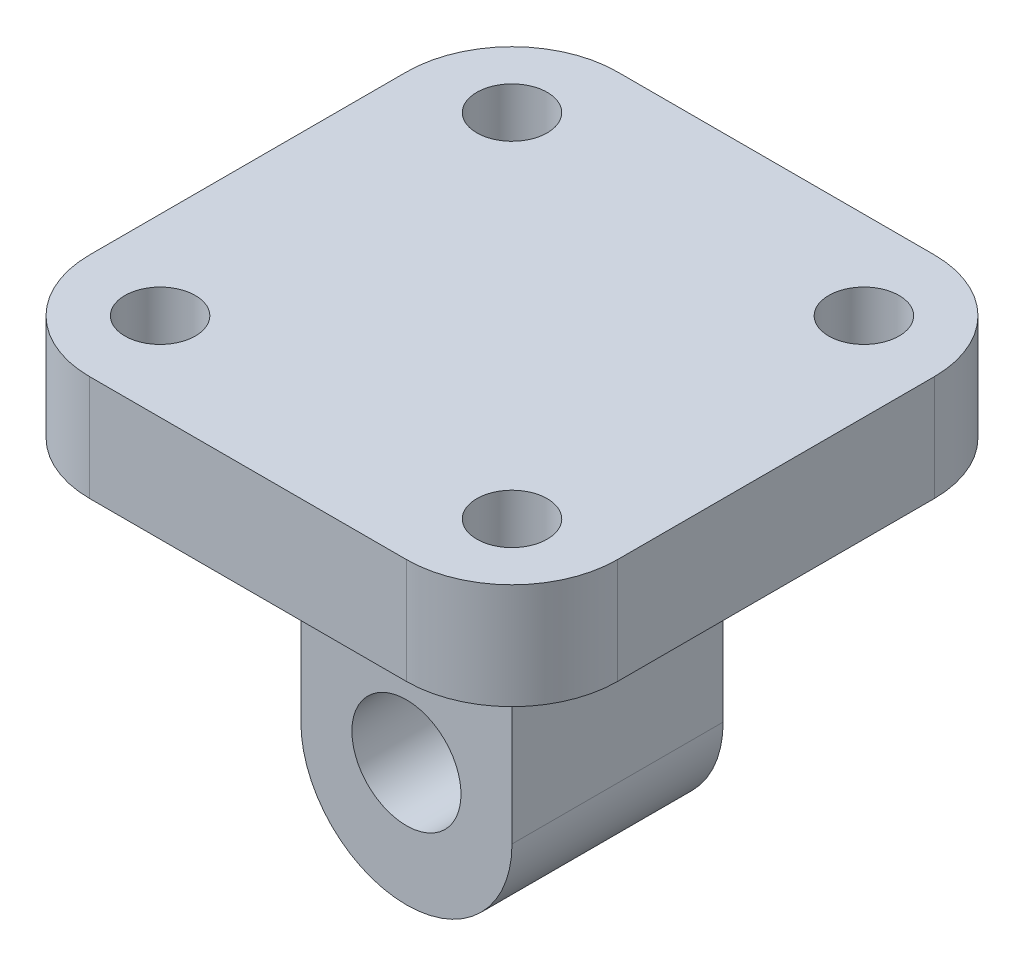
from build123d import *

# Parameters (mm, degrees)
SKETCH1_W           = 15
SKETCH1_H           = 15
BOSS_EXTRUDE1_DEPTH = 3
SKETCH3_R           = 1
CUT_EXTRUDE1_DEPTH  = 22.424285286
FILLET1_R           = 3
SKETCH4_W           = 6
SKETCH4_H           = 6
BOSS_EXTRUDE2_DEPTH = 10
SKETCH5_R           = 1.55
CUT_EXTRUDE2_DEPTH  = 21.862646045
FILLET2_R           = 3
FILLET3_R           = 2


# Some blends are built 0.0001 mm under size
with BuildPart() as part:
    # Sketch1 → Boss-Extrude1 (new body)
    with BuildSketch(Plane(origin=(0, 0, 0), x_dir=(1, 0, 0), z_dir=(0, 1, 0))):
        with Locations((7.5, -7.5)):
            Rectangle(SKETCH1_W, SKETCH1_H)
    extrude(amount=BOSS_EXTRUDE1_DEPTH)

    # Sketch3 → Cut-Extrude1 (cut, through all)
    with BuildSketch(Plane(origin=(0, 3, 0), x_dir=(1, 0, 0), z_dir=(0, 1, 0))):
        with Locations(Location((2.5, -12.5, 0), (0, 0, 270))):
            Circle(SKETCH3_R)
        with Locations(Location((12.5, -12.5, 0), (0, 0, 270))):
            Circle(SKETCH3_R)
        with Locations(Location((12.5, -2.5, 0), (0, 0, 270))):
            Circle(SKETCH3_R)
        with Locations(Location((2.5, -2.5, 0), (0, 0, 270))):
            Circle(SKETCH3_R)
    extrude(amount=-CUT_EXTRUDE1_DEPTH, mode=Mode.SUBTRACT)

    # Fillet1
    fillet1_edges = [part.edges().sort_by_distance(p)[0] for p in [
        (0, 1.5, 0),
        (15, 1.5, 0),
        (15, 1.5, 15),
        (0, 1.5, 15),
    ]]
    fillet(fillet1_edges, radius=FILLET1_R)

    # Sketch4 → Boss-Extrude2 (add)
    with BuildSketch(Plane(origin=(0, 0, 0), x_dir=(-1, 0, 0), z_dir=(0, -1, 0))):
        with Locations((-7.5, -7.5)):
            Rectangle(SKETCH4_W, SKETCH4_H)
    extrude(amount=BOSS_EXTRUDE2_DEPTH)

    # Sketch5 → Cut-Extrude2 (cut, through all)
    with BuildSketch(Plane(origin=(0, 0, 4.5), x_dir=(-1, 0, 0), z_dir=(0, 0, -1))):
        with Locations((-7.5, -6.5)):
            Circle(SKETCH5_R)
    extrude(amount=-CUT_EXTRUDE2_DEPTH, mode=Mode.SUBTRACT)

    # Fillet2
    fillet2_edges = [part.edges().sort_by_distance(p)[0] for p in [
        (10.5, -10, 7.5),
        (4.5, -10, 7.5),
    ]]
    fillet(fillet2_edges, radius=FILLET2_R - 0.0001)  # a hair under: the kernel refuses the full size

    # Fillet3
    # the kernel refuses this fillet: 2 mm, written as the material it adds along each edge
    with BuildSketch(Plane(origin=(10.5, 0, 10.5), x_dir=(0, -1, 0), z_dir=(0, 0, -1)), Plane(origin=(4.5, 0, 10.5), x_dir=(0, -1, 0), z_dir=(1, 0, 0))) as fillet3_piece_1:
        with BuildLine():
            CenterArc((FILLET3_R, -FILLET3_R), FILLET3_R, 90, 90)
            Line((0, -FILLET3_R), (0, 0))
            Line((0, 0), (FILLET3_R, 0))
        make_face()
    extrude(amount=6)
    with BuildSketch(Plane(origin=(4.5, 0, 4.5), x_dir=(-1, 0, 0), z_dir=(0, 0, 1)), Plane(origin=(10.5, 0, 4.5), x_dir=(0, 0, -1), z_dir=(-1, 0, 0))) as fillet3_piece_2:
        with BuildLine():
            CenterArc((FILLET3_R, FILLET3_R), FILLET3_R, 180, 90)
            Line((0, FILLET3_R), (0, 0))
            Line((0, 0), (FILLET3_R, 0))
        make_face()
    extrude(amount=6)
    with BuildSketch(Plane(origin=(10.5, 0, 15.5), x_dir=(0, -1, 0), z_dir=(0, 0, -1))) as fillet3_piece_3a_section:
        with BuildLine():
            CenterArc((FILLET3_R, -FILLET3_R), FILLET3_R, 90, 90)
            Line((0, -FILLET3_R), (0, 0))
            Line((0, 0), (FILLET3_R, 0))
        make_face()
    fillet3_piece_3a = extrude(amount=11, mode=Mode.PRIVATE)
    fillet3_piece_3a = split(fillet3_piece_3a, bisect_by=Plane(origin=(10.928031961, -0.460476413, 10.5), z_dir=(0, 0, 1)), keep=Keep.TOP, mode=Mode.PRIVATE)
    fillet3_piece_3a = fillet3_piece_3a & Plane(origin=(12, -0.460476413, 12), x_dir=(1, 0, 0), z_dir=(0, 1, 0)) * Cylinder(3, 30, mode=Mode.PRIVATE)
    fillet3_piece_3a = fillet3_piece_3a - Plane(origin=(12.5, -0.460476413, 12.5), x_dir=(0, 0, 1), z_dir=(0, 1, 0)) * Cylinder(1, 30, mode=Mode.PRIVATE)
    with BuildSketch(Plane(origin=(4.5, 0, 10.5), x_dir=(0, -1, 0), z_dir=(1, 0, 0))) as fillet3_piece_3b_section:
        with BuildLine():
            CenterArc((FILLET3_R, -FILLET3_R), FILLET3_R, 90, 90)
            Line((0, -FILLET3_R), (0, 0))
            Line((0, 0), (FILLET3_R, 0))
        make_face()
    fillet3_piece_3b = extrude(amount=11, mode=Mode.PRIVATE)
    fillet3_piece_3b = split(fillet3_piece_3b, bisect_by=Plane(origin=(10.5, -0.460476368, 10.928032026), z_dir=(1, 0, 0)), keep=Keep.TOP, mode=Mode.PRIVATE)
    fillet3_piece_3b = fillet3_piece_3b & Plane(origin=(12, -0.460476368, 12), x_dir=(1, 0, 0), z_dir=(0, 1, 0)) * Cylinder(3, 31, mode=Mode.PRIVATE)
    fillet3_piece_3b = fillet3_piece_3b - Plane(origin=(12.5, -0.460476368, 12.5), x_dir=(0, 0, 1), z_dir=(0, 1, 0)) * Cylinder(1, 31, mode=Mode.PRIVATE)
    fillet3_piece_3 = fillet3_piece_3a & fillet3_piece_3b
    add(fillet3_piece_3)
    with BuildSketch(Plane(origin=(10.5, 0, 10.5), x_dir=(0, -1, 0), z_dir=(0, 0, -1))) as fillet3_piece_4a_section:
        with BuildLine():
            CenterArc((FILLET3_R, -FILLET3_R), FILLET3_R, 90, 90)
            Line((0, -FILLET3_R), (0, 0))
            Line((0, 0), (FILLET3_R, 0))
        make_face()
    fillet3_piece_4a = extrude(amount=11, mode=Mode.PRIVATE)
    fillet3_piece_4a = split(fillet3_piece_4a, bisect_by=Plane(origin=(10.928032026, -0.460476368, 4.5), z_dir=(0, 0, -1)), keep=Keep.TOP, mode=Mode.PRIVATE)
    fillet3_piece_4a = fillet3_piece_4a & Plane(origin=(12, -0.460476368, 3), x_dir=(0, 0, -1), z_dir=(0, 1, 0)) * Cylinder(3, 30, mode=Mode.PRIVATE)
    fillet3_piece_4a = fillet3_piece_4a - Plane(origin=(12.5, -0.460476368, 2.5), x_dir=(0, 0, 1), z_dir=(0, 1, 0)) * Cylinder(1, 30, mode=Mode.PRIVATE)
    with BuildSketch(Plane(origin=(15.5, 0, 4.5), x_dir=(0, 0, -1), z_dir=(-1, 0, 0))) as fillet3_piece_4b_section:
        with BuildLine():
            CenterArc((FILLET3_R, FILLET3_R), FILLET3_R, 180, 90)
            Line((0, FILLET3_R), (0, 0))
            Line((0, 0), (FILLET3_R, 0))
        make_face()
    fillet3_piece_4b = extrude(amount=11, mode=Mode.PRIVATE)
    fillet3_piece_4b = split(fillet3_piece_4b, bisect_by=Plane(origin=(10.5, -0.460476818, 4.071968325), z_dir=(1, 0, 0)), keep=Keep.TOP, mode=Mode.PRIVATE)
    fillet3_piece_4b = fillet3_piece_4b & Plane(origin=(12, -0.460476818, 3), x_dir=(0, 0, -1), z_dir=(0, 1, 0)) * Cylinder(3, 30, mode=Mode.PRIVATE)
    fillet3_piece_4b = fillet3_piece_4b - Plane(origin=(12.5, -0.460476818, 2.5), x_dir=(0, 0, 1), z_dir=(0, 1, 0)) * Cylinder(1, 30, mode=Mode.PRIVATE)
    fillet3_piece_4 = fillet3_piece_4a & fillet3_piece_4b
    add(fillet3_piece_4)
    with BuildSketch(Plane(origin=(-0.5, 0, 10.5), x_dir=(0, -1, 0), z_dir=(1, 0, 0))) as fillet3_piece_5a_section:
        with BuildLine():
            CenterArc((FILLET3_R, -FILLET3_R), FILLET3_R, 90, 90)
            Line((0, -FILLET3_R), (0, 0))
            Line((0, 0), (FILLET3_R, 0))
        make_face()
    fillet3_piece_5a = extrude(amount=11, mode=Mode.PRIVATE)
    fillet3_piece_5a = split(fillet3_piece_5a, bisect_by=Plane(origin=(4.5, -0.460476374, 10.928031998), z_dir=(-1, 0, 0)), keep=Keep.TOP, mode=Mode.PRIVATE)
    fillet3_piece_5a = fillet3_piece_5a & Plane(origin=(3, -0.460476374, 12), x_dir=(-1, 0, 0), z_dir=(0, 1, 0)) * Cylinder(3, 30, mode=Mode.PRIVATE)
    fillet3_piece_5a = fillet3_piece_5a - Plane(origin=(2.5, -0.460476374, 12.5), x_dir=(0, 0, 1), z_dir=(0, 1, 0)) * Cylinder(1, 30, mode=Mode.PRIVATE)
    with BuildSketch(Plane(origin=(4.5, 0, 4.5), x_dir=(-1, 0, 0), z_dir=(0, 0, 1))) as fillet3_piece_5b_section:
        with BuildLine():
            CenterArc((FILLET3_R, FILLET3_R), FILLET3_R, 180, 90)
            Line((0, FILLET3_R), (0, 0))
            Line((0, 0), (FILLET3_R, 0))
        make_face()
    fillet3_piece_5b = extrude(amount=11, mode=Mode.PRIVATE)
    fillet3_piece_5b = split(fillet3_piece_5b, bisect_by=Plane(origin=(4.071967841, -0.460476686, 10.5), z_dir=(0, 0, 1)), keep=Keep.TOP, mode=Mode.PRIVATE)
    fillet3_piece_5b = fillet3_piece_5b & Plane(origin=(3, -0.460476686, 12), x_dir=(-1, 0, 0), z_dir=(0, 1, 0)) * Cylinder(3, 30, mode=Mode.PRIVATE)
    fillet3_piece_5b = fillet3_piece_5b - Plane(origin=(2.5, -0.460476686, 12.5), x_dir=(0, 0, 1), z_dir=(0, 1, 0)) * Cylinder(1, 30, mode=Mode.PRIVATE)
    fillet3_piece_5 = fillet3_piece_5a & fillet3_piece_5b
    add(fillet3_piece_5)
    with BuildSketch(Plane(origin=(4.5, 0, -0.5), x_dir=(-1, 0, 0), z_dir=(0, 0, 1))) as fillet3_piece_6a_section:
        with BuildLine():
            CenterArc((FILLET3_R, FILLET3_R), FILLET3_R, 180, 90)
            Line((0, FILLET3_R), (0, 0))
            Line((0, 0), (FILLET3_R, 0))
        make_face()
    fillet3_piece_6a = extrude(amount=11, mode=Mode.PRIVATE)
    fillet3_piece_6a = fillet3_piece_6a & Plane(origin=(3, -0.460476683, 3), x_dir=(0, 0, -1), z_dir=(0, 1, 0)) * Cylinder(3, 30, mode=Mode.PRIVATE)
    fillet3_piece_6a = fillet3_piece_6a - Plane(origin=(2.5, -0.460476683, 2.5), x_dir=(0, 0, 1), z_dir=(0, 1, 0)) * Cylinder(1, 30, mode=Mode.PRIVATE)
    fillet3_piece_6a = split(fillet3_piece_6a, bisect_by=Plane(origin=(4.071967813, -0.460476683, 4.5), z_dir=(0, 0, -1)), keep=Keep.TOP, mode=Mode.PRIVATE)
    with BuildSketch(Plane(origin=(10.5, 0, 4.5), x_dir=(0, 0, -1), z_dir=(-1, 0, 0))) as fillet3_piece_6b_section:
        with BuildLine():
            CenterArc((FILLET3_R, FILLET3_R), FILLET3_R, 180, 90)
            Line((0, FILLET3_R), (0, 0))
            Line((0, 0), (FILLET3_R, 0))
        make_face()
    fillet3_piece_6b = extrude(amount=11, mode=Mode.PRIVATE)
    fillet3_piece_6b = fillet3_piece_6b & Plane(origin=(3, -0.460476796, 3), x_dir=(0, 0, -1), z_dir=(0, 1, 0)) * Cylinder(3, 30, mode=Mode.PRIVATE)
    fillet3_piece_6b = fillet3_piece_6b - Plane(origin=(2.5, -0.460476796, 2.5), x_dir=(0, 0, 1), z_dir=(0, 1, 0)) * Cylinder(1, 30, mode=Mode.PRIVATE)
    fillet3_piece_6b = split(fillet3_piece_6b, bisect_by=Plane(origin=(4.5, -0.460476796, 4.071968238), z_dir=(-1, 0, 0)), keep=Keep.TOP, mode=Mode.PRIVATE)
    fillet3_piece_6 = fillet3_piece_6a & fillet3_piece_6b
    add(fillet3_piece_6)


solid = part.part
